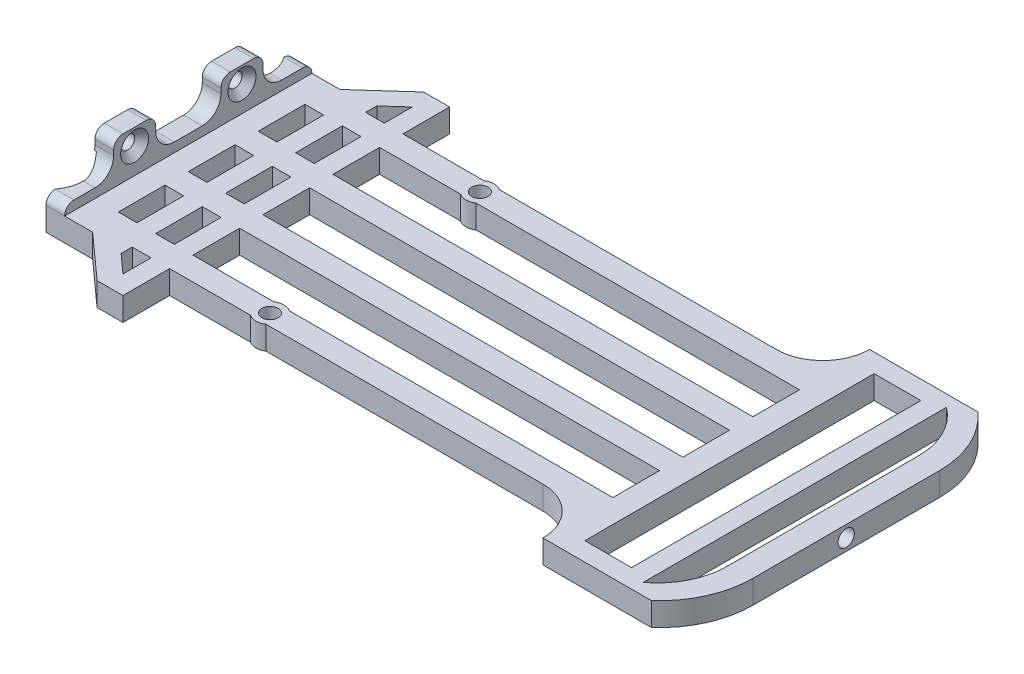
from build123d import *

# Parameters (mm, degrees)
Y_KSEKLIK_EKSTR_ZYON1_DEPTH = 7
IZIM2_R                     = 1.5
KES_EKSTR_ZYON1_DEPTH       = 7
PAH1_SIZE                   = 2.5
IZIM3_R                     = 2
KES_EKSTR_ZYON2_DEPTH       = 10
KES_EKSTR_ZYON3_START       = -10
IZIM4_R                     = 2
KES_EKSTR_ZYON3_DEPTH       = 10
RADYUS1_R                   = 20
IZIM5_W                     = 90
IZIM5_H                     = 10
IZIM5_W_2                   = 10
IZIM5_H_2                   = 70
KES_EKSTR_ZYON4_DEPTH       = 10
RADYUS2_R                   = 4
KES_EKSTR_ZYON5_DEPTH       = 10
IZIM8_W                     = 5
IZIM8_H                     = 53
KES_EKSTR_ZYON6_DEPTH       = 10
IZIM9_W                     = 8.724341423
IZIM9_H                     = 2.178581573
IZIM9_W_2                   = 9.164333206
Y_KSEKLIK_EKSTR_ZYON2_DEPTH = 10
IZIM10_W                    = 140
IZIM10_H                    = 10
KES_EKSTR_ZYON7_DEPTH       = 10
IZIM11_W                    = 10
IZIM11_H                    = 4
Y_KSEKLIK_EKSTR_ZYON3_DEPTH = 7
RADYUS3_R                   = 10
IZIM12_W                    = 4
IZIM12_H                    = 9
Y_KSEKLIK_EKSTR_ZYON4_DEPTH = 7
RADYUS4_R                   = 4
IZIM13_R                    = 1.5
KES_EKSTR_ZYON8_DEPTH       = 7
PAH2_SIZE                   = 1.5
RADYUS5_R                   = 2
IZIM14_W                    = 144.535934645
IZIM14_H                    = 70
KES_EKSTR_ZYON9_DEPTH       = 2
RADYUS6_R                   = 2
KES_EKSTR_ZYON10_DEPTH      = 5
KES_EKSTR_ZYON10_DEPTH_BACK = 5
IZIM15_R                    = 7.5
IZIM16_R                    = 1.75
KES_EKSTR_ZYON11_DEPTH      = 7
IZIM17_R                    = 1.75
KES_EKSTR_ZYON12_DEPTH      = 10
Y_KSEKLIK_EKSTR_ZYON5_START = -5
IZIM18_R                    = 3
IZIM18_R_2                  = 2
Y_KSEKLIK_EKSTR_ZYON5_DEPTH = 5
IZIM19_W                    = 4
IZIM19_H                    = 10
KES_EKSTR_ZYON13_DEPTH      = 10


# Some blends are built 0.0001 mm under size
with BuildPart() as part:
    # Çizim1 → Yükseklik-Ekstrüzyon1 (new body)
    with BuildSketch(Plane(origin=(0, 0, 0), x_dir=(1, 0, 0), z_dir=(0, 1, 0))):
        Polygon((0, 0), (0, 53), (15, 53), (30, 66.5), (150, 66.5), (150, -13.5), (30, -13.5), (15, 0), align=None)
    extrude(amount=Y_KSEKLIK_EKSTR_ZYON1_DEPTH)

    # Çizim2 → Kes-Ekstrüzyon1 (cut)
    with BuildSketch(Plane(origin=(0, 7, 0), x_dir=(1, 0, 0), z_dir=(0, 1, 0))):
        with Locations(Location((2.5, 41.25, 0), (0, 0, 270))):
            Circle(IZIM2_R)
        with Locations(Location((2.5, 11.75, 0), (0, 0, 270))):
            Circle(IZIM2_R)
    extrude(amount=-KES_EKSTR_ZYON1_DEPTH, mode=Mode.SUBTRACT)

    # Pah1
    # the kernel refuses this chamfer: 2.5 mm, written as the material it takes off along each edge
    with BuildSketch(Plane(origin=(2.5, 7, -41.25), x_dir=(0, 0, 1), z_dir=(-1, 0, 0))) as pah1_piece_1:
        Polygon((1.5 + PAH1_SIZE, 0), (1.5, -PAH1_SIZE), (1.5, 0), align=None)
    revolve(axis=Axis((2.5, 7, -41.25), (0, 1, 0)), mode=Mode.SUBTRACT)
    with BuildSketch(Plane(origin=(2.5, 7, -11.75), x_dir=(0, 0, 1), z_dir=(-1, 0, 0))) as pah1_piece_2:
        Polygon((1.5 + PAH1_SIZE, 0), (1.5, -PAH1_SIZE), (1.5, 0), align=None)
    revolve(axis=Axis((2.5, 7, -11.75), (0, 1, 0)), mode=Mode.SUBTRACT)

    # Çizim3 → Kes-Ekstrüzyon2 (cut)
    with BuildSketch(Plane.XY.offset(13.5)):
        with Locations((46.24, 3.5)):
            Circle(IZIM3_R)
    extrude(amount=-KES_EKSTR_ZYON2_DEPTH, mode=Mode.SUBTRACT)

    # Çizim4 → Kes-Ekstrüzyon3 (cut)
    with BuildSketch(Plane(origin=(0, 0, -66.5), x_dir=(-1, 0, 0), z_dir=(0, 0, -1)).offset(KES_EKSTR_ZYON3_START)):
        with Locations(Location((-46.24, 3.5, 0), (0, 0, 180))):
            Circle(IZIM4_R)
    extrude(amount=KES_EKSTR_ZYON3_DEPTH, mode=Mode.SUBTRACT)

    # Radyus1
    radyus1_edges = [part.edges().sort_by_distance(p)[0] for p in [
        (150, 3.5, -66.5),
        (150, 3.5, 13.5),
    ]]
    fillet(radyus1_edges, radius=RADYUS1_R)

    # Çizim5 → Kes-Ekstrüzyon4 (cut)
    with BuildSketch(Plane(origin=(0, 7, 0), x_dir=(1, 0, 0), z_dir=(0, 1, 0))):
        with Locations((75, -3.5)):
            Rectangle(IZIM5_W, IZIM5_H)
        with Locations((75, 26.5)):
            Rectangle(IZIM5_W, IZIM5_H)
        with Locations((75, 41.5)):
            Rectangle(IZIM5_W, IZIM5_H)
        with Locations((75, 56.5)):
            Rectangle(IZIM5_W, IZIM5_H)
        with Locations((75, 11.5)):
            Rectangle(IZIM5_W, IZIM5_H)
        with Locations((130, 26.5)):
            Rectangle(IZIM5_W_2, IZIM5_H_2)
    extrude(amount=-KES_EKSTR_ZYON4_DEPTH, mode=Mode.SUBTRACT)

    # Radyus2
    radyus2_edges = [part.edges().sort_by_distance(p)[0] for p in [
        (135, 3.5, -61.5),
        (135, 3.5, 8.5),
    ]]
    fillet(radyus2_edges, radius=RADYUS2_R)

    # Çizim6 → Kes-Ekstrüzyon5 (cut)
    with BuildSketch(Plane(origin=(0, 7, 0), x_dir=(1, 0, 0), z_dir=(0, 1, 0))):
        with BuildLine():
            Line((139, -6), (139, 59))
            ThreePointArc((139, 59), (143.530979443, 53.484870133), (145, 46.5))
            Line((145, 46.5), (145, 6.5))
            ThreePointArc((145, 6.5), (143.530979443, -0.484870133), (139, -6))
        make_face()
    extrude(amount=-KES_EKSTR_ZYON5_DEPTH, mode=Mode.SUBTRACT)

    # Çizim8 → Kes-Ekstrüzyon6 (cut)
    with BuildSketch(Plane(origin=(0, 7, 0), x_dir=(1, 0, 0), z_dir=(0, 1, 0))):
        with Locations((2.5, 26.5)):
            Rectangle(IZIM8_W, IZIM8_H)
    extrude(amount=-KES_EKSTR_ZYON6_DEPTH, mode=Mode.SUBTRACT)

    # Çizim9 → Yükseklik-Ekstrüzyon2 (add)
    with BuildSketch(Plane.ZY.offset(-5)):
        with Locations((-12.430411948, 5.910709214)):
            Rectangle(IZIM9_W, IZIM9_H)
        with Locations((-41.247168871, 5.910709214)):
            Rectangle(IZIM9_W_2, IZIM9_H)
    extrude(amount=-Y_KSEKLIK_EKSTR_ZYON2_DEPTH)

    # Çizim10 → Kes-Ekstrüzyon7 (cut)
    with BuildSketch(Plane(origin=(0, 7, 0), x_dir=(1, 0, 0), z_dir=(0, 1, 0))):
        with Locations((85, -13.5)):
            Rectangle(IZIM10_W, IZIM10_H)
        with Locations((85, 66.5)):
            Rectangle(IZIM10_W, IZIM10_H)
    extrude(amount=-KES_EKSTR_ZYON7_DEPTH, mode=Mode.SUBTRACT)


with BuildPart() as kes_ekstr_zyon7_piece_1:
    # of the separate pieces the step leaves, piece 1, a body of its own (kes_ekstr_zyon7_pieces)
    add(part.part.solids().sort_by_distance((24.444444444, 0, 8.5))[0])



with BuildPart() as kes_ekstr_zyon7_piece_2:
    # of the separate pieces the step leaves, piece 2, a body of its own (kes_ekstr_zyon7_pieces)
    add(part.part.solids().sort_by_distance((143.228756555, 0, 8.5))[0])


with BuildPart() as kes_ekstr_zyon7_piece_1_1:
    add(kes_ekstr_zyon7_piece_1.part)

    add(kes_ekstr_zyon7_piece_2.part)  # Yükseklik-Ekstrüzyon3 merges Kes-Ekstrüzyon7 piece 2
    # Çizim11 → Yükseklik-Ekstrüzyon3 (add)
    with BuildSketch(Plane(origin=(0, 7, 0), x_dir=(1, 0, 0), z_dir=(0, 1, 0))):
        with Locations((130, -6.5)):
            Rectangle(IZIM11_W, IZIM11_H)
        with Locations((130, 59.5)):
            Rectangle(IZIM11_W, IZIM11_H)
    extrude(amount=-Y_KSEKLIK_EKSTR_ZYON3_DEPTH)

    # Radyus3
    radyus3_edges = [kes_ekstr_zyon7_piece_1_1.edges().sort_by_distance(p)[0] for p in [
        (120, 3.5, -1.5),
        (120, 3.5, -51.5),
    ]]
    fillet(radyus3_edges, radius=RADYUS3_R - 0.0001)  # a hair under: the kernel refuses the full size

    # Çizim12 → Yükseklik-Ekstrüzyon4 (add)
    with BuildSketch(Plane(origin=(0, 7, 0), x_dir=(1, 0, 0), z_dir=(0, 1, 0))):
        with Locations((7, 15)):
            Rectangle(IZIM12_W, IZIM12_H)
        with Locations((7, 38)):
            Rectangle(IZIM12_W, IZIM12_H)
    extrude(amount=Y_KSEKLIK_EKSTR_ZYON4_DEPTH)

    # Radyus4
    radyus4_edges = [kes_ekstr_zyon7_piece_1_1.edges().sort_by_distance(p)[0] for p in [
        (7, 7, -10.5),
        (7, 7, -19.5),
        (7, 7, -33.5),
        (7, 7, -42.5),
    ]]
    fillet(radyus4_edges, radius=RADYUS4_R)

    # Çizim13 → Kes-Ekstrüzyon8 (cut)
    with BuildSketch(Plane.ZY.offset(-5)):
        with Locations((-38, 10.5)):
            Circle(IZIM13_R)
        with Locations((-15, 10.5)):
            Circle(IZIM13_R)
    extrude(amount=-KES_EKSTR_ZYON8_DEPTH, mode=Mode.SUBTRACT)

    # Pah2
    pah2_edges = [kes_ekstr_zyon7_piece_1_1.edges().sort_by_distance(p)[0] for p in [
        (9, 10.5, -39.5),
        (9, 10.5, -16.5),
    ]]
    chamfer(pah2_edges, length=PAH2_SIZE)

    # Radyus5
    radyus5_edges = [kes_ekstr_zyon7_piece_1_1.edges().sort_by_distance(p)[0] for p in [
        (7, 14, -10.5),
        (7, 14, -19.5),
        (7, 14, -33.5),
        (7, 14, -42.5),
    ]]
    fillet(radyus5_edges, radius=RADYUS5_R)

    # Çizim14 → Kes-Ekstrüzyon9 (cut)
    with BuildSketch(Plane(origin=(0, 7, 0), x_dir=(1, 0, 0), z_dir=(0, 1, 0))):
        with Locations((81.267967322, 26.5)):
            Rectangle(IZIM14_W, IZIM14_H)
    extrude(amount=-KES_EKSTR_ZYON9_DEPTH, mode=Mode.SUBTRACT)

    # Radyus6
    radyus6_edges = [kes_ekstr_zyon7_piece_1_1.edges().sort_by_distance(p)[0] for p in [
        (7, 7, 0),
        (7, 7, -53),
    ]]
    fillet(radyus6_edges, radius=RADYUS6_R)

    # Çizim15 → Kes-Ekstrüzyon10 (cut, two sides: drawn at the far end of the back side and taken through both)
    with BuildSketch(Plane(origin=(0, 5, 0), x_dir=(1, 0, 0), z_dir=(0, 1, 0)).offset(-KES_EKSTR_ZYON10_DEPTH_BACK)):
        with Locations((-1, 46.5)):
            Circle(IZIM15_R)
        with Locations((-1, 6.5)):
            Circle(IZIM15_R)
    extrude(amount=KES_EKSTR_ZYON10_DEPTH + KES_EKSTR_ZYON10_DEPTH_BACK, mode=Mode.SUBTRACT)

    # Çizim16 → Kes-Ekstrüzyon11 (cut)
    with BuildSketch(Plane(origin=(150, 0, 0), x_dir=(0, 0, -1), z_dir=(1, 0, 0))):
        with Locations((26.5, 2.5)):
            Circle(IZIM16_R)
    extrude(amount=-KES_EKSTR_ZYON11_DEPTH, mode=Mode.SUBTRACT)

    # Çizim17 → Kes-Ekstrüzyon12 (cut)
    with BuildSketch(Plane.XZ):
        with Locations(Location((49, -4, 0), (0, 0, 270))):
            Circle(IZIM17_R)
        with Locations(Location((49, -49, 0), (0, 0, 270))):
            Circle(IZIM17_R)
    extrude(amount=-KES_EKSTR_ZYON12_DEPTH, mode=Mode.SUBTRACT)

    # Çizim18 → Yükseklik-Ekstrüzyon5 (add)
    # profile 1 of 2: a face of its own
    with BuildSketch(Plane.XZ.offset(Y_KSEKLIK_EKSTR_ZYON5_START)):
        with Locations((49, -4)):
            Circle(IZIM18_R)
        with Locations((49, -4)):
            Circle(IZIM18_R_2, mode=Mode.SUBTRACT)
    # profile 2 of 2: a face of its own
    with BuildSketch(Plane.XZ.offset(Y_KSEKLIK_EKSTR_ZYON5_START)):
        with Locations((49, -49)):
            Circle(IZIM18_R)
        with Locations((49, -49)):
            Circle(IZIM18_R_2, mode=Mode.SUBTRACT)
    extrude(amount=Y_KSEKLIK_EKSTR_ZYON5_DEPTH)

    # Çizim19 → Kes-Ekstrüzyon13 (cut)
    with BuildSketch(Plane(origin=(0, 5, 0), x_dir=(1, 0, 0), z_dir=(0, 1, 0))):
        Polygon((22, 51.5), (26, 51.5), (26, 57.5), (22, 53.9), align=None)
        with Locations((24, 41.5)):
            Rectangle(IZIM19_W, IZIM19_H)
        with Locations((24, 26.5)):
            Rectangle(IZIM19_W, IZIM19_H)
        with Locations((24, 11.5)):
            Rectangle(IZIM19_W, IZIM19_H)
        Polygon((22, 1.5), (26, 1.5), (26, -4.5), (22, -0.9), align=None)
        with Locations((16, 41.5)):
            Rectangle(IZIM19_W, IZIM19_H)
        with Locations((16, 26.5)):
            Rectangle(IZIM19_W, IZIM19_H)
        with Locations((16, 11.5)):
            Rectangle(IZIM19_W, IZIM19_H)
    extrude(amount=-KES_EKSTR_ZYON13_DEPTH, mode=Mode.SUBTRACT)


solid = kes_ekstr_zyon7_piece_1_1.part
